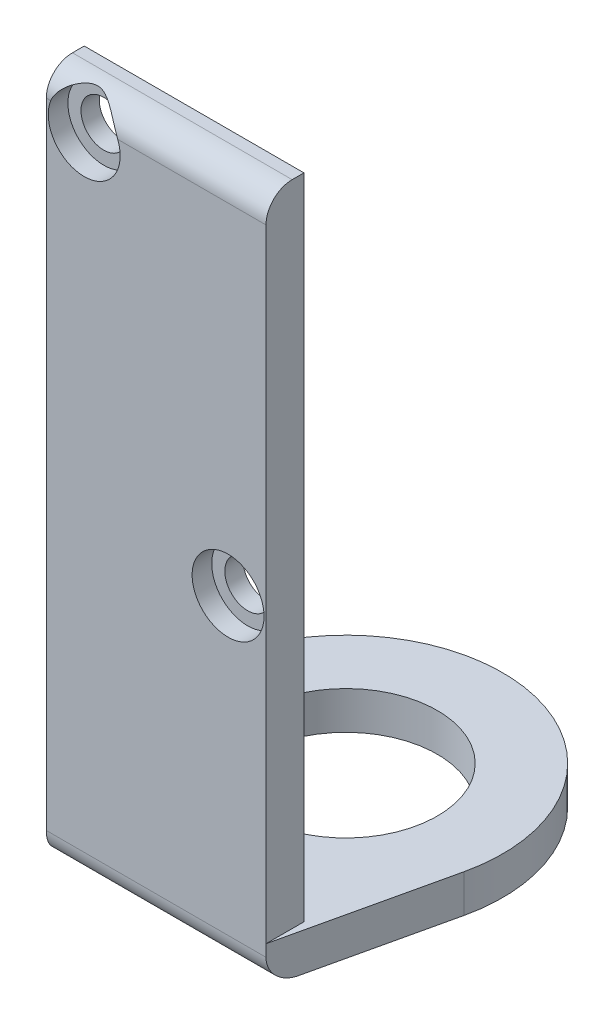
from build123d import *

# Parameters (mm, degrees)
SALIENTE_EXTRUIR1_DEPTH = 52.5
CORTAR_EXTRUIR3_REACH   = 40.766
CROQUIS3_R              = 1.75
CROQUIS4_R              = 2.75
CORTAR_EXTRUIR4_DEPTH   = 1.5
CROQUIS5_R              = 7
SALIENTE_EXTRUIR2_DEPTH = 2.9
REDONDEO1_R             = 2


with BuildPart() as part:
    # Croquis2 → Saliente-Extruir1 (new body)
    with BuildSketch(Plane(origin=(0, 33.282514016, 0), x_dir=(1, 0, 0), z_dir=(0, 1, 0))):
        Polygon((19.664416593, -1), (19.664416593, -0.1), (2.864416593, -0.1), (2.864416593, -1), (2.864416593, -3), (19.664416593, -3), align=None)
    extrude(amount=-SALIENTE_EXTRUIR1_DEPTH)

    # Croquis3 → Cortar-Extruir3 (cut, up to next)
    with BuildSketch(Plane.XY.offset(3), mode=Mode.PRIVATE) as cortar_extruir3_sk1:
        with Locations((5.764416593, 30.282514016)):
            Circle(CROQUIS3_R)
    cortar_extruir3_tool1 = extrude(cortar_extruir3_sk1.sketch, amount=-CORTAR_EXTRUIR3_REACH, mode=Mode.PRIVATE) & part.part
    # Croquis3 → Cortar-Extruir3 (cut, up to next)
    with BuildSketch(Plane.XY.offset(3), mode=Mode.PRIVATE) as cortar_extruir3_sk2:
        with Locations((16.764416593, 5.282514016)):
            Circle(CROQUIS3_R)
    cortar_extruir3_tool2 = extrude(cortar_extruir3_sk2.sketch, amount=-CORTAR_EXTRUIR3_REACH, mode=Mode.PRIVATE) & part.part
    add(cortar_extruir3_tool1.solids().sort_by_distance((5.764417, 30.282514, 3))[0], mode=Mode.SUBTRACT)
    add(cortar_extruir3_tool2.solids().sort_by_distance((16.764417, 5.282514, 3))[0], mode=Mode.SUBTRACT)

    # Croquis4 → Cortar-Extruir4 (cut)
    with BuildSketch(Plane.XY.offset(3)):
        with Locations((5.764416593, 30.282514016)):
            Circle(CROQUIS4_R)
        with Locations((16.764416593, 5.282514016)):
            Circle(CROQUIS4_R)
    extrude(amount=-CORTAR_EXTRUIR4_DEPTH, mode=Mode.SUBTRACT)

    # Croquis5 → Saliente-Extruir2 (add)
    with BuildSketch(Plane(origin=(0, -19.217485984, 0), x_dir=(1, 0, 0), z_dir=(0, 1, 0))):
        with BuildLine():
            Line((2.864416593, -3), (19.664416593, -3))
            Line((19.664416593, -3), (22.46664072, 9.343319648))
            ThreePointArc((22.46664072, 9.343319648), (10.29394354, 23.990773749), (-0.693676229, 8.434595553))
            Line((-0.693676229, 8.434595553), (2.864416593, -3))
        make_face()
        with Locations(Location((10.764416593, 12, 0), (0, 0, 270))):
            Circle(CROQUIS5_R, mode=Mode.SUBTRACT)
    extrude(amount=SALIENTE_EXTRUIR2_DEPTH)

    # Redondeo1
    # the kernel refuses this fillet: 2 mm, written as the material it takes off along each edge
    with BuildSketch(Plane(origin=(-2.135583407, -19.217485984, 3), x_dir=(0, 1, 0), z_dir=(1, 0, 0))) as redondeo1_piece_1:
        with BuildLine():
            CenterArc((REDONDEO1_R, -REDONDEO1_R), REDONDEO1_R, 90, 90)
            Line((0, -REDONDEO1_R), (0, 0))
            Line((0, 0), (REDONDEO1_R, 0))
        make_face()
    extrude(amount=26.8, mode=Mode.SUBTRACT)
    with BuildSketch(Plane(origin=(-2.135583407, 33.282514016, 3), x_dir=(0, -1, 0), z_dir=(1, 0, 0))) as redondeo1_piece_2:
        with BuildLine():
            CenterArc((REDONDEO1_R, REDONDEO1_R), REDONDEO1_R, 180, 90)
            Line((0, REDONDEO1_R), (0, 0))
            Line((0, 0), (REDONDEO1_R, 0))
        make_face()
    extrude(amount=26.8, mode=Mode.SUBTRACT)


solid = part.part
